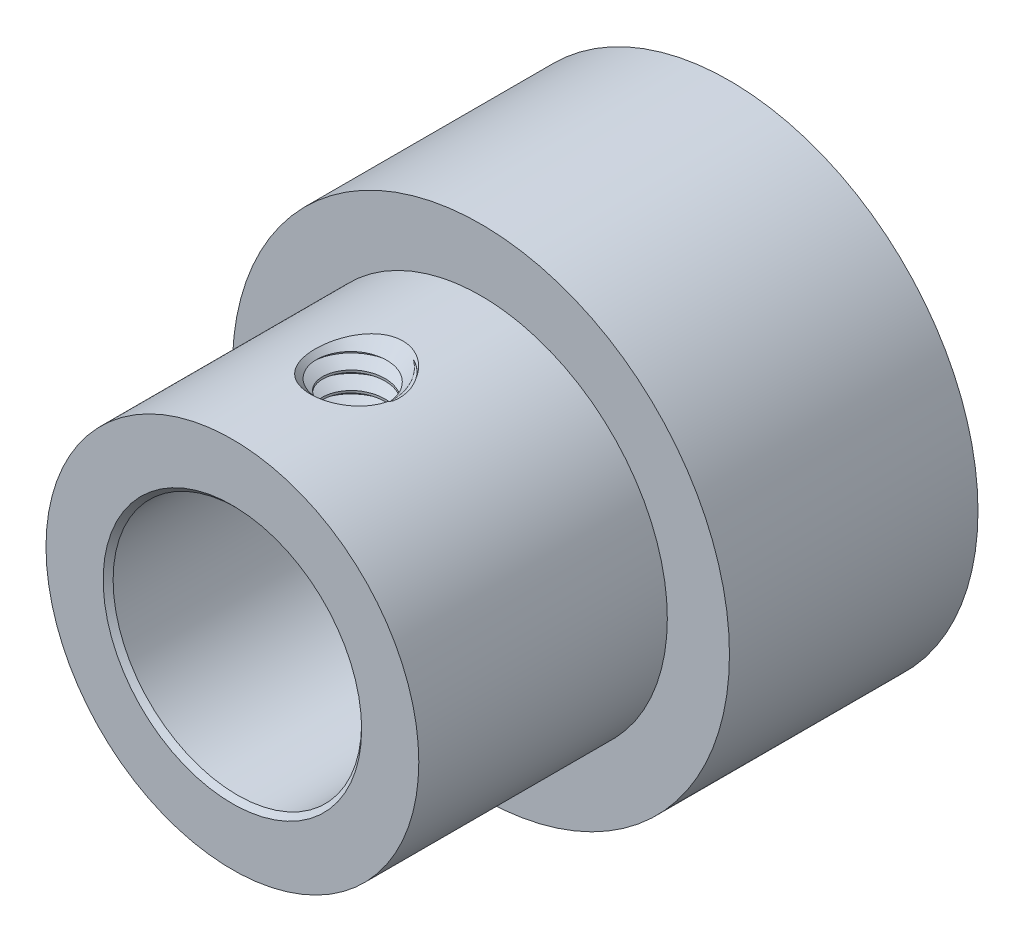
from build123d import *

# Parameters (mm, degrees)
SKETCH1_R           = 6.35
SKETCH1_R_2         = 4.7625
BOSS_EXTRUDE1_DEPTH = 3.175
SKETCH2_R           = 4.7625
SKETCH2_R_2         = 3.175
BOSS_EXTRUDE2_DEPTH = 3.175
SKETCH8_R           = 4.7625
SKETCH8_R_2         = 3.175
BOSS_EXTRUDE5_DEPTH = 6.35
SKETCH3_R           = 1.0922
BOSS_EXTRUDE3_DEPTH = 4.7625
CUT_SWEEP3_PITCH    = 0.453571429
CHAMFER1_SIZE       = 0.127


with BuildPart() as part:
    # Sketch1 → Boss-Extrude1 (new, symmetric)
    with BuildSketch(Plane.XY):
        Circle(SKETCH1_R)
        Circle(SKETCH1_R_2, mode=Mode.SUBTRACT)
    extrude(amount=BOSS_EXTRUDE1_DEPTH, both=True)


with BuildPart() as body_2:
    # Sketch2 → Boss-Extrude2 (new, symmetric)
    with BuildSketch(Plane.XY):
        Circle(SKETCH2_R)
        Circle(SKETCH2_R_2, mode=Mode.SUBTRACT)
    extrude(amount=BOSS_EXTRUDE2_DEPTH, both=True)

    # Sketch8 → Boss-Extrude5 (add)
    with BuildSketch(Plane.XY.offset(3.175)):
        Circle(SKETCH8_R)
        Circle(SKETCH8_R_2, mode=Mode.SUBTRACT)
    extrude(amount=BOSS_EXTRUDE5_DEPTH)


with BuildPart() as body_3:
    # Sketch3 → Boss-Extrude3 (new body)
    with BuildSketch(Plane(origin=(0, 0, 0), x_dir=(1, 0, 0), z_dir=(0, 1, 0))):
        with Locations(Location((0, -6.35, 0), (0, 0, 270))):
            Circle(SKETCH3_R)
    extrude(amount=BOSS_EXTRUDE3_DEPTH)

    # Cut-Sweep3: the profile of Sketch5 profile screwed along a right-hand helix of 14 turns, 6 arcs to a turn; built about Z, then put on its axis
    cut_sweep3_z = Axis((0, 0, 0), (0, 0, 1))
    cut_sweep3_corners = [(1.0925, 0, 0.000173205), (1.0925, 0, -0.397048205), (0.797596715, 0, -0.226785714), (0.797596715, 0, -0.170089286)]
    with BuildLine(mode=Mode.PRIVATE) as cut_sweep3_profile:
        Line(cut_sweep3_corners[0], cut_sweep3_corners[1])
        Line(cut_sweep3_corners[1], cut_sweep3_corners[2])
        Line(cut_sweep3_corners[2], cut_sweep3_corners[3])
        Line(cut_sweep3_corners[3], cut_sweep3_corners[0])
    cut_sweep3_cap = Face(cut_sweep3_profile.wire())
    cut_sweep3_turn_angles = [0, 30, 60, 90, 120, 150, 180, 210, 240, 270, 300, 330, 360]
    cut_sweep3_turn_weights = [1, 0.8660254037844387, 1, 0.8660254037844387, 1, 0.8660254037844387, 1, 0.8660254037844387, 1, 0.8660254037844387, 1, 0.8660254037844387, 1]
    cut_sweep3_turn_rails = [Edge.make_bspline([Vector(p[0], p[1], 0).rotate(cut_sweep3_z, cut_sweep3_turn_angles[k]) / cut_sweep3_turn_weights[k] + Vector(0, 0, p[2] + CUT_SWEEP3_PITCH * cut_sweep3_turn_angles[k] / 360) for k in range(13)], [0, 0, 0, 1, 1, 2, 2, 3, 3, 4, 4, 5, 5, 6, 6, 6], 2, cut_sweep3_turn_weights) for p in cut_sweep3_corners]
    cut_sweep3_turn_sides = [Face.make_surface_from_curves(cut_sweep3_turn_rails[p[0]], cut_sweep3_turn_rails[p[1]]) for p in [(0, 1), (1, 2), (2, 3), (3, 0)]]
    cut_sweep3 = Plane(origin=(0, 4.7625, 6.35), x_dir=(0, 0, -1), z_dir=(0, -1, 0)) * Solid(Shell([*[p.moved(Location((0, 0, CUT_SWEEP3_PITCH * i))) for i in range(14) for p in cut_sweep3_turn_sides], cut_sweep3_cap, cut_sweep3_cap.rotate(cut_sweep3_z, 5040).moved(Location((0, 0, CUT_SWEEP3_PITCH * 5040 / 360)))]))
    add(cut_sweep3, mode=Mode.SUBTRACT)

    # Boss-Extrude4 cone 1 section (through the dimple's axis) → Boss-Extrude4 (revolve)
    with BuildSketch(Plane(origin=(0, 4.7625, 6.35), x_dir=(0, 0, 1), z_dir=(1, 0, 0))):
        Polygon((0, 0), (1.179576, 0), (0, 1.179576), align=None)
    revolve(axis=Axis((0, 4.7625, 6.35), (0, -1, 0)))


with BuildPart() as body_2_1:
    add(body_2.part)

    # Combine2: cut body 3
    add(body_3.part, mode=Mode.SUBTRACT)

    # Chamfer1
    chamfer1_edges = [body_2_1.edges().sort_by_distance(p)[0] for p in [
        (-3.175, 0, 9.525),
        (-3.175, 0, -3.175),
    ]]
    chamfer(chamfer1_edges, length=CHAMFER1_SIZE)


solid = Compound([part.part, body_2_1.part])
